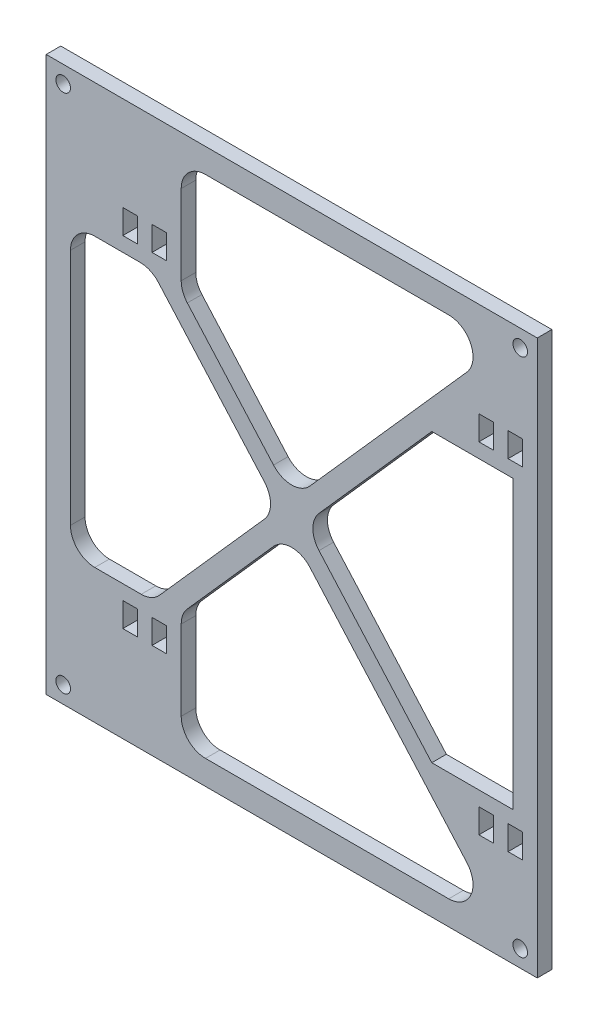
from build123d import *

# Parameters (mm, degrees)
SKETCH1_R           = 1.5
BOSS_EXTRUDE1_DEPTH = 3
SKETCH2_W           = 3
SKETCH2_H           = 5
BOSS_EXTRUDE2_DEPTH = 3
CUT_EXTRUDE1_START  = -3
CUT_EXTRUDE1_DEPTH  = 3
SKETCH3_W           = 3
SKETCH3_H           = 5
BOSS_EXTRUDE3_DEPTH = 3
SKETCH3_2_W         = 3
SKETCH3_2_H         = 5
CUT_EXTRUDE2_DEPTH  = 3
FILLET4_R           = 5


with BuildPart() as part:
    # Sketch1 → Boss-Extrude1 (new body)
    with BuildSketch(Plane.XY):
        Polygon((71.686424942, 53.861993355), (71.686424942, 56.877946104), (69.01439663, 56.877946104), (-29.313575058, 56.877946104), (-29.313575058, -54.106101147), (-29.313575058, -57.122053896), (-26.641546745, -57.122053896), (69.01439663, -57.122053896), (71.686424942, -57.122053896), (71.686424942, -54.106101147), align=None)
        with Locations((-25.813575058, -53.622053896)):
            Circle(SKETCH1_R, mode=Mode.SUBTRACT)
        with BuildLine():
            Line((53.474676725, -52.122053896), (-11.101826841, -52.122053896))
            ThreePointArc((-11.101826841, -52.122053896), (-15.66135034, -49.174063999), (-14.844302156, -43.806352082))
            Line((-14.844302156, -43.806352082), (17.443949627, -7.362186703))
            ThreePointArc((17.443949627, -7.362186703), (21.186424942, -5.677888517), (24.928900257, -7.362186703))
            Line((24.928900257, -7.362186703), (57.21715204, -43.806352082))
            ThreePointArc((57.21715204, -43.806352082), (58.034200224, -49.174063999), (53.474676725, -52.122053896))
        make_face(mode=Mode.SUBTRACT)
        with Locations((68.186424942, -53.622053896)):
            Circle(SKETCH1_R, mode=Mode.SUBTRACT)
        with BuildLine():
            ThreePointArc((-15.571099743, -38.594792376), (-21.086654783, -39.954150806), (-24.313575058, -35.279090562))
            Line((-24.313575058, -35.279090562), (-24.313575058, 35.03498277))
            ThreePointArc((-24.313575058, 35.03498277), (-21.086654783, 39.710043015), (-15.571099743, 38.350684584))
            Line((-15.571099743, 38.350684584), (15.576801163, 3.193647918))
            ThreePointArc((15.576801163, 3.193647918), (16.834325848, -0.122053896), (15.576801163, -3.43775571))
            Line((15.576801163, -3.43775571), (-15.571099743, -38.594792376))
        make_face(mode=Mode.SUBTRACT)
        with Locations((-25.813575058, 53.377946104)):
            Circle(SKETCH1_R, mode=Mode.SUBTRACT)
        with BuildLine():
            Line((66.686424942, 35.03498277), (66.686424942, -35.279090562))
            ThreePointArc((66.686424942, -35.279090562), (63.459504668, -39.954150806), (57.943949627, -38.594792376))
            Line((57.943949627, -38.594792376), (26.796048721, -3.43775571))
            ThreePointArc((26.796048721, -3.43775571), (25.538524036, -0.122053896), (26.796048721, 3.193647918))
            Line((26.796048721, 3.193647918), (57.943949627, 38.350684584))
            ThreePointArc((57.943949627, 38.350684584), (63.459504668, 39.710043015), (66.686424942, 35.03498277))
        make_face(mode=Mode.SUBTRACT)
        with BuildLine():
            ThreePointArc((-14.844302156, 43.56224429), (-15.66135034, 48.929956208), (-11.101826841, 51.877946104))
            Line((-11.101826841, 51.877946104), (53.474676725, 51.877946104))
            ThreePointArc((53.474676725, 51.877946104), (58.034200224, 48.929956208), (57.21715204, 43.56224429))
            Line((57.21715204, 43.56224429), (24.928900257, 7.118078911))
            ThreePointArc((24.928900257, 7.118078911), (21.186424942, 5.433780725), (17.443949627, 7.118078911))
            Line((17.443949627, 7.118078911), (-14.844302156, 43.56224429))
        make_face(mode=Mode.SUBTRACT)
        with Locations((68.186424942, 53.377946104)):
            Circle(SKETCH1_R, mode=Mode.SUBTRACT)
    extrude(amount=BOSS_EXTRUDE1_DEPTH)

    # Sketch2 → Boss-Extrude2 (add)
    # profile 1 of 2: a face of its own
    with BuildSketch(Plane.XY.offset(3)):
        Polygon((70.099284753, 29.377946104), (49.994418167, 29.377946104), (70.099284753, 52.745180187), align=None)
        with Locations((67.186424942, 34.877946104)):
            Rectangle(SKETCH2_W, SKETCH2_H, mode=Mode.SUBTRACT)
        with Locations((61.186424942, 34.877946104)):
            Rectangle(SKETCH2_W, SKETCH2_H, mode=Mode.SUBTRACT)
    # profile 2 of 2: a face of its own
    with BuildSketch(Plane.XY.offset(3)):
        Polygon((69.750004308, -29.622053896), (49.994418167, -29.622053896), (69.750004308, -51.920438253), align=None)
        with Locations((67.186424942, -35.122053896)):
            Rectangle(SKETCH2_W, SKETCH2_H, mode=Mode.SUBTRACT)
        with Locations((61.186424942, -35.122053896)):
            Rectangle(SKETCH2_W, SKETCH2_H, mode=Mode.SUBTRACT)
    extrude(amount=-BOSS_EXTRUDE2_DEPTH)

    # Sketch2<2> → Cut-Extrude1 (cut)
    with BuildSketch(Plane.XY.offset(3).offset(CUT_EXTRUDE1_START)):
        Polygon((68.686424942, -32.622053896), (66.686424942, -32.622053896), (65.686424942, -32.622053896), (65.686424942, -37.622053896), (68.686424942, -37.622053896), align=None)
        with BuildLine():
            Line((68.686424942, 37.377946104), (66.103496689, 37.377946104))
            ThreePointArc((66.103496689, 37.377946104), (66.538504843, 36.242178129), (66.686424942, 35.03498277))
            Line((66.686424942, 35.03498277), (66.686424942, 32.377946104))
            Line((66.686424942, 32.377946104), (68.686424942, 32.377946104))
            Line((68.686424942, 32.377946104), (68.686424942, 37.377946104))
        make_face()
    extrude(amount=CUT_EXTRUDE1_DEPTH, mode=Mode.SUBTRACT)

    # Sketch3 → Boss-Extrude3 (add)
    with BuildSketch(Plane.XY.offset(3)):
        Polygon((-1.541842902, -27.004830212), (-1.541842902, -52.122053896), (-24.313575058, -52.122053896), (-24.313575058, -29.5), (-7.513432814, -29.5), align=None)
        with Locations((-12.041842902, -35)):
            Rectangle(SKETCH3_W, SKETCH3_H, mode=Mode.SUBTRACT)
        with Locations((-6.041842902, -35)):
            Rectangle(SKETCH3_W, SKETCH3_H, mode=Mode.SUBTRACT)
    boss_extrude3 = extrude(amount=-BOSS_EXTRUDE3_DEPTH)

    # Sketch3<2> → Cut-Extrude2 (cut)
    with BuildSketch(Plane.XY.offset(3)):
        with Locations((-12.041842902, -35)):
            Rectangle(SKETCH3_2_W, SKETCH3_2_H)
        with Locations((-6.041842902, -35)):
            Rectangle(SKETCH3_2_W, SKETCH3_2_H)
    cut_extrude2 = extrude(amount=-CUT_EXTRUDE2_DEPTH, mode=Mode.SUBTRACT)

    # Mirror1: Boss-Extrude3, Cut-Extrude2 across plane
    add(boss_extrude3.mirror(Plane.ZX))
    add(cut_extrude2.mirror(Plane.ZX), mode=Mode.SUBTRACT)

    # Fillet4
    fillet4_edges = [part.edges().sort_by_distance(p)[0] for p in [
        (-7.513432814, -29.5, 1.5),
        (-24.313575058, -29.5, 1.5),
        (-1.541842902, -52.122053896, 1.5),
        (-1.541842902, -28.791695102, 1.5),
        (-1.541842902, 51.877946104, 1.5),
        (-1.541842902, 28.547587311, 1.5),
        (-24.313575058, 29.5, 1.5),
        (-7.729703752, 29.5, 1.5),
    ]]
    fillet(fillet4_edges, radius=FILLET4_R)


solid = part.part
